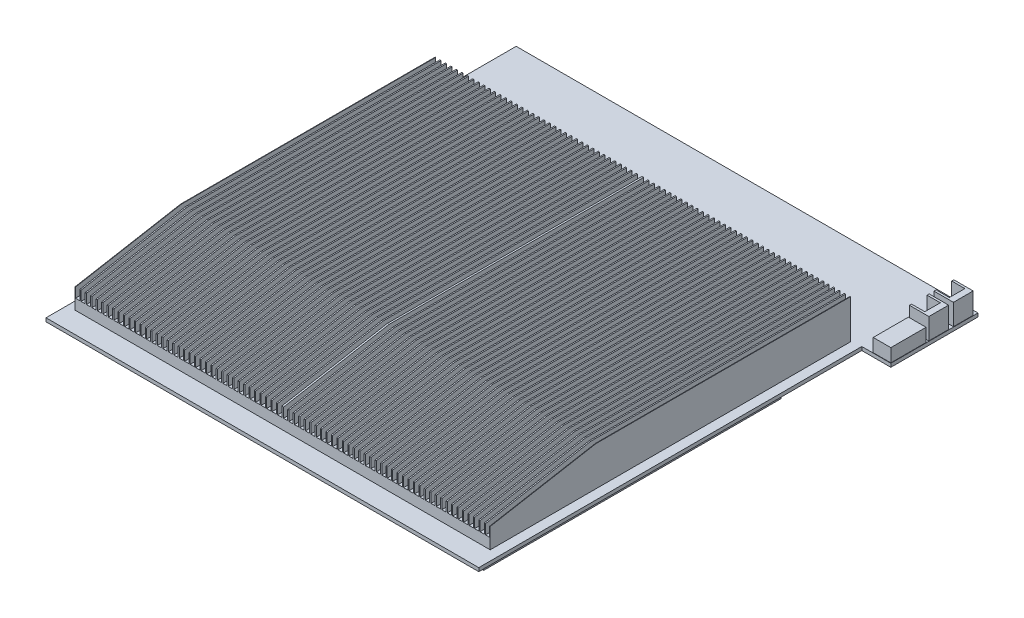
from build123d import *

# Parameters (mm, degrees)
BOSS_EXTRUDE1_DEPTH   = 2
SKETCH2_W             = 235.75
SKETCH2_H             = 204.5
BOSS_EXTRUDE2_DEPTH   = 22.2
CUT_EXTRUDE1_DEPTH    = 235.75
SKETCH5_W             = 27.3
SKETCH5_H             = 30.25
BOSS_EXTRUDE4_DEPTH   = 12.75
SKETCH6_W             = 2.4
SKETCH6_H             = 16.2
CUT_EXTRUDE2_DEPTH    = 341.929541841
SKETCH7_W             = 2.4
SKETCH7_H             = 10.810120739
CUT_EXTRUDE3_DEPTH    = 365.678988975
SKETCH8_W             = 10
SKETCH8_H             = 20
BOSS_EXTRUDE5_DEPTH   = 7.5
BOSS_EXTRUDE6_DEPTH   = 12
BOSS_EXTRUDE6_2_DEPTH = 12


with BuildPart() as part:
    # Sketch1 → Boss-Extrude1 (new body)
    with BuildSketch(Plane(origin=(0, 0, 0), x_dir=(1, 0, 0), z_dir=(0, 1, 0))):
        Polygon((0, 0), (0, 267), (262.25, 267), (262.25, 217.5), (245.75, 217.5), (245.75, 0), align=None)
    extrude(amount=BOSS_EXTRUDE1_DEPTH)

    # Sketch2 → Boss-Extrude2 (add)
    with BuildSketch(Plane(origin=(0, 2, 0), x_dir=(1, 0, 0), z_dir=(0, 1, 0))):
        with Locations((122.375, 114.25)):
            Rectangle(SKETCH2_W, SKETCH2_H)
    extrude(amount=BOSS_EXTRUDE2_DEPTH)

    # Sketch3 → Cut-Extrude1 (cut)
    with BuildSketch(Plane(origin=(240.25, 0, 0), x_dir=(0, 0, -1), z_dir=(1, 0, 0))):
        Polygon((12, 13.5), (72, 24.2), (12, 24.2), align=None)
    extrude(amount=-CUT_EXTRUDE1_DEPTH, mode=Mode.SUBTRACT)

    # Sketch5 → Boss-Extrude4 (add)
    with BuildSketch(Plane.XZ):
        Polygon((7.969075183, -183.75), (7.969075183, -14.75), (233.75849879, -14.75), (233.75849879, -183.75), (174.25849879, -183.75), (174.25849879, -216.5), (67.469075183, -216.5), (67.469075183, -183.75), align=None)
        with Locations((136.200813534, -246.375)):
            Rectangle(SKETCH5_W, SKETCH5_H)
    extrude(amount=BOSS_EXTRUDE4_DEPTH)

    # Sketch6 → Cut-Extrude2 (cut, through all)
    with BuildSketch(Plane(origin=(0, 0, -216.5), x_dir=(-1, 0, 0), z_dir=(0, 0, -1))):
        with Locations((-124.075, 16.1)):
            Rectangle(SKETCH6_W, SKETCH6_H)
        with Locations((-120.675, 16.1)):
            Rectangle(SKETCH6_W, SKETCH6_H)
        with Locations((-127.175, 16.1)):
            Rectangle(SKETCH6_W, SKETCH6_H)
        with Locations((-130.275, 16.1)):
            Rectangle(SKETCH6_W, SKETCH6_H)
        with Locations((-133.375, 16.1)):
            Rectangle(SKETCH6_W, SKETCH6_H)
        with Locations((-136.475, 16.1)):
            Rectangle(SKETCH6_W, SKETCH6_H)
        with Locations((-139.575, 16.1)):
            Rectangle(SKETCH6_W, SKETCH6_H)
        with Locations((-142.675, 16.1)):
            Rectangle(SKETCH6_W, SKETCH6_H)
        with Locations((-145.775, 16.1)):
            Rectangle(SKETCH6_W, SKETCH6_H)
        with Locations((-148.875, 16.1)):
            Rectangle(SKETCH6_W, SKETCH6_H)
        with Locations((-151.975, 16.1)):
            Rectangle(SKETCH6_W, SKETCH6_H)
        with Locations((-155.075, 16.1)):
            Rectangle(SKETCH6_W, SKETCH6_H)
        with Locations((-158.175, 16.1)):
            Rectangle(SKETCH6_W, SKETCH6_H)
        with Locations((-161.275, 16.1)):
            Rectangle(SKETCH6_W, SKETCH6_H)
        with Locations((-164.375, 16.1)):
            Rectangle(SKETCH6_W, SKETCH6_H)
        with Locations((-167.475, 16.1)):
            Rectangle(SKETCH6_W, SKETCH6_H)
        with Locations((-170.575, 16.1)):
            Rectangle(SKETCH6_W, SKETCH6_H)
        with Locations((-173.675, 16.1)):
            Rectangle(SKETCH6_W, SKETCH6_H)
        with Locations((-176.775, 16.1)):
            Rectangle(SKETCH6_W, SKETCH6_H)
        with Locations((-179.875, 16.1)):
            Rectangle(SKETCH6_W, SKETCH6_H)
        with Locations((-182.975, 16.1)):
            Rectangle(SKETCH6_W, SKETCH6_H)
        with Locations((-186.075, 16.1)):
            Rectangle(SKETCH6_W, SKETCH6_H)
        with Locations((-189.175, 16.1)):
            Rectangle(SKETCH6_W, SKETCH6_H)
        with Locations((-192.275, 16.1)):
            Rectangle(SKETCH6_W, SKETCH6_H)
        with Locations((-195.375, 16.1)):
            Rectangle(SKETCH6_W, SKETCH6_H)
        with Locations((-198.475, 16.1)):
            Rectangle(SKETCH6_W, SKETCH6_H)
        with Locations((-201.575, 16.1)):
            Rectangle(SKETCH6_W, SKETCH6_H)
        with Locations((-204.675, 16.1)):
            Rectangle(SKETCH6_W, SKETCH6_H)
        with Locations((-207.775, 16.1)):
            Rectangle(SKETCH6_W, SKETCH6_H)
        with Locations((-210.875, 16.1)):
            Rectangle(SKETCH6_W, SKETCH6_H)
        with Locations((-213.975, 16.1)):
            Rectangle(SKETCH6_W, SKETCH6_H)
        with Locations((-217.075, 16.1)):
            Rectangle(SKETCH6_W, SKETCH6_H)
        with Locations((-220.175, 16.1)):
            Rectangle(SKETCH6_W, SKETCH6_H)
        with Locations((-223.275, 16.1)):
            Rectangle(SKETCH6_W, SKETCH6_H)
        with Locations((-226.375, 16.1)):
            Rectangle(SKETCH6_W, SKETCH6_H)
        with Locations((-229.475, 16.1)):
            Rectangle(SKETCH6_W, SKETCH6_H)
        with Locations((-232.575, 16.1)):
            Rectangle(SKETCH6_W, SKETCH6_H)
        with Locations((-235.675, 16.1)):
            Rectangle(SKETCH6_W, SKETCH6_H)
        with Locations((-238.775, 16.1)):
            Rectangle(SKETCH6_W, SKETCH6_H)
        with Locations((-117.575, 16.1)):
            Rectangle(SKETCH6_W, SKETCH6_H)
        with Locations((-114.475, 16.1)):
            Rectangle(SKETCH6_W, SKETCH6_H)
        with Locations((-111.375, 16.1)):
            Rectangle(SKETCH6_W, SKETCH6_H)
        with Locations((-108.275, 16.1)):
            Rectangle(SKETCH6_W, SKETCH6_H)
        with Locations((-105.175, 16.1)):
            Rectangle(SKETCH6_W, SKETCH6_H)
        with Locations((-102.075, 16.1)):
            Rectangle(SKETCH6_W, SKETCH6_H)
        with Locations((-98.975, 16.1)):
            Rectangle(SKETCH6_W, SKETCH6_H)
        with Locations((-95.875, 16.1)):
            Rectangle(SKETCH6_W, SKETCH6_H)
        with Locations((-92.775, 16.1)):
            Rectangle(SKETCH6_W, SKETCH6_H)
        with Locations((-89.675, 16.1)):
            Rectangle(SKETCH6_W, SKETCH6_H)
        with Locations((-86.575, 16.1)):
            Rectangle(SKETCH6_W, SKETCH6_H)
        with Locations((-83.475, 16.1)):
            Rectangle(SKETCH6_W, SKETCH6_H)
        with Locations((-80.375, 16.1)):
            Rectangle(SKETCH6_W, SKETCH6_H)
        with Locations((-77.275, 16.1)):
            Rectangle(SKETCH6_W, SKETCH6_H)
        with Locations((-74.175, 16.1)):
            Rectangle(SKETCH6_W, SKETCH6_H)
        with Locations((-71.075, 16.1)):
            Rectangle(SKETCH6_W, SKETCH6_H)
        with Locations((-67.975, 16.1)):
            Rectangle(SKETCH6_W, SKETCH6_H)
        with Locations((-64.875, 16.1)):
            Rectangle(SKETCH6_W, SKETCH6_H)
        with Locations((-61.775, 16.1)):
            Rectangle(SKETCH6_W, SKETCH6_H)
        with Locations((-58.675, 16.1)):
            Rectangle(SKETCH6_W, SKETCH6_H)
        with Locations((-55.575, 16.1)):
            Rectangle(SKETCH6_W, SKETCH6_H)
        with Locations((-52.475, 16.1)):
            Rectangle(SKETCH6_W, SKETCH6_H)
        with Locations((-49.375, 16.1)):
            Rectangle(SKETCH6_W, SKETCH6_H)
        with Locations((-46.275, 16.1)):
            Rectangle(SKETCH6_W, SKETCH6_H)
        with Locations((-43.175, 16.1)):
            Rectangle(SKETCH6_W, SKETCH6_H)
        with Locations((-40.075, 16.1)):
            Rectangle(SKETCH6_W, SKETCH6_H)
        with Locations((-36.975, 16.1)):
            Rectangle(SKETCH6_W, SKETCH6_H)
        with Locations((-33.875, 16.1)):
            Rectangle(SKETCH6_W, SKETCH6_H)
        with Locations((-30.775, 16.1)):
            Rectangle(SKETCH6_W, SKETCH6_H)
        with Locations((-27.675, 16.1)):
            Rectangle(SKETCH6_W, SKETCH6_H)
        with Locations((-24.575, 16.1)):
            Rectangle(SKETCH6_W, SKETCH6_H)
        with Locations((-21.475, 16.1)):
            Rectangle(SKETCH6_W, SKETCH6_H)
        with Locations((-18.375, 16.1)):
            Rectangle(SKETCH6_W, SKETCH6_H)
        with Locations((-15.275, 16.1)):
            Rectangle(SKETCH6_W, SKETCH6_H)
        with Locations((-12.175, 16.1)):
            Rectangle(SKETCH6_W, SKETCH6_H)
        with Locations((-9.075, 16.1)):
            Rectangle(SKETCH6_W, SKETCH6_H)
        with Locations((-5.975, 16.1)):
            Rectangle(SKETCH6_W, SKETCH6_H)
    extrude(amount=-CUT_EXTRUDE2_DEPTH, mode=Mode.SUBTRACT)

    # Sketch7 → Cut-Extrude3 (cut, through all)
    with BuildSketch(Plane.XY.offset(-14.75)):
        with Locations((118.663786987, -7.34493963)):
            Rectangle(SKETCH7_W, SKETCH7_H)
        with Locations((123.063786987, -7.34493963)):
            Rectangle(SKETCH7_W, SKETCH7_H)
        with Locations((126.163786987, -7.34493963)):
            Rectangle(SKETCH7_W, SKETCH7_H)
        with Locations((129.263786987, -7.34493963)):
            Rectangle(SKETCH7_W, SKETCH7_H)
        with Locations((132.363786987, -7.34493963)):
            Rectangle(SKETCH7_W, SKETCH7_H)
        with Locations((135.463786987, -7.34493963)):
            Rectangle(SKETCH7_W, SKETCH7_H)
        with Locations((138.563786987, -7.34493963)):
            Rectangle(SKETCH7_W, SKETCH7_H)
        with Locations((141.663786987, -7.34493963)):
            Rectangle(SKETCH7_W, SKETCH7_H)
        with Locations((144.763786987, -7.34493963)):
            Rectangle(SKETCH7_W, SKETCH7_H)
        with Locations((147.863786987, -7.34493963)):
            Rectangle(SKETCH7_W, SKETCH7_H)
        with Locations((150.963786987, -7.34493963)):
            Rectangle(SKETCH7_W, SKETCH7_H)
        with Locations((154.063786987, -7.34493963)):
            Rectangle(SKETCH7_W, SKETCH7_H)
        with Locations((157.163786987, -7.34493963)):
            Rectangle(SKETCH7_W, SKETCH7_H)
        with Locations((160.263786987, -7.34493963)):
            Rectangle(SKETCH7_W, SKETCH7_H)
        with Locations((163.363786987, -7.34493963)):
            Rectangle(SKETCH7_W, SKETCH7_H)
        with Locations((166.463786987, -7.34493963)):
            Rectangle(SKETCH7_W, SKETCH7_H)
        with Locations((169.563786987, -7.34493963)):
            Rectangle(SKETCH7_W, SKETCH7_H)
        with Locations((172.663786987, -7.34493963)):
            Rectangle(SKETCH7_W, SKETCH7_H)
        with Locations((175.763786987, -7.34493963)):
            Rectangle(SKETCH7_W, SKETCH7_H)
        with Locations((178.863786987, -7.34493963)):
            Rectangle(SKETCH7_W, SKETCH7_H)
        with Locations((181.963786987, -7.34493963)):
            Rectangle(SKETCH7_W, SKETCH7_H)
        with Locations((185.063786987, -7.34493963)):
            Rectangle(SKETCH7_W, SKETCH7_H)
        with Locations((188.163786987, -7.34493963)):
            Rectangle(SKETCH7_W, SKETCH7_H)
        with Locations((191.263786987, -7.34493963)):
            Rectangle(SKETCH7_W, SKETCH7_H)
        with Locations((194.363786987, -7.34493963)):
            Rectangle(SKETCH7_W, SKETCH7_H)
        with Locations((197.463786987, -7.34493963)):
            Rectangle(SKETCH7_W, SKETCH7_H)
        with Locations((200.563786987, -7.34493963)):
            Rectangle(SKETCH7_W, SKETCH7_H)
        with Locations((203.663786987, -7.34493963)):
            Rectangle(SKETCH7_W, SKETCH7_H)
        with Locations((206.763786987, -7.34493963)):
            Rectangle(SKETCH7_W, SKETCH7_H)
        with Locations((209.863786987, -7.34493963)):
            Rectangle(SKETCH7_W, SKETCH7_H)
        with Locations((212.963786987, -7.34493963)):
            Rectangle(SKETCH7_W, SKETCH7_H)
        with Locations((216.063786987, -7.34493963)):
            Rectangle(SKETCH7_W, SKETCH7_H)
        with Locations((219.163786987, -7.34493963)):
            Rectangle(SKETCH7_W, SKETCH7_H)
        with Locations((222.263786987, -7.34493963)):
            Rectangle(SKETCH7_W, SKETCH7_H)
        with Locations((225.363786987, -7.34493963)):
            Rectangle(SKETCH7_W, SKETCH7_H)
        with Locations((228.463786987, -7.34493963)):
            Rectangle(SKETCH7_W, SKETCH7_H)
        with Locations((231.563786987, -7.34493963)):
            Rectangle(SKETCH7_W, SKETCH7_H)
        with Locations((115.563786987, -7.34493963)):
            Rectangle(SKETCH7_W, SKETCH7_H)
        with Locations((112.463786987, -7.34493963)):
            Rectangle(SKETCH7_W, SKETCH7_H)
        with Locations((109.363786987, -7.34493963)):
            Rectangle(SKETCH7_W, SKETCH7_H)
        with Locations((106.263786987, -7.34493963)):
            Rectangle(SKETCH7_W, SKETCH7_H)
        with Locations((103.163786987, -7.34493963)):
            Rectangle(SKETCH7_W, SKETCH7_H)
        with Locations((100.063786987, -7.34493963)):
            Rectangle(SKETCH7_W, SKETCH7_H)
        with Locations((96.963786987, -7.34493963)):
            Rectangle(SKETCH7_W, SKETCH7_H)
        with Locations((93.863786987, -7.34493963)):
            Rectangle(SKETCH7_W, SKETCH7_H)
        with Locations((90.763786987, -7.34493963)):
            Rectangle(SKETCH7_W, SKETCH7_H)
        with Locations((87.663786987, -7.34493963)):
            Rectangle(SKETCH7_W, SKETCH7_H)
        with Locations((84.563786987, -7.34493963)):
            Rectangle(SKETCH7_W, SKETCH7_H)
        with Locations((81.463786987, -7.34493963)):
            Rectangle(SKETCH7_W, SKETCH7_H)
        with Locations((78.363786987, -7.34493963)):
            Rectangle(SKETCH7_W, SKETCH7_H)
        with Locations((75.263786987, -7.34493963)):
            Rectangle(SKETCH7_W, SKETCH7_H)
        with Locations((72.163786987, -7.34493963)):
            Rectangle(SKETCH7_W, SKETCH7_H)
        with Locations((69.063786987, -7.34493963)):
            Rectangle(SKETCH7_W, SKETCH7_H)
        with Locations((65.963786987, -7.34493963)):
            Rectangle(SKETCH7_W, SKETCH7_H)
        with Locations((62.863786987, -7.34493963)):
            Rectangle(SKETCH7_W, SKETCH7_H)
        with Locations((59.763786987, -7.34493963)):
            Rectangle(SKETCH7_W, SKETCH7_H)
        with Locations((56.663786987, -7.34493963)):
            Rectangle(SKETCH7_W, SKETCH7_H)
        with Locations((53.563786987, -7.34493963)):
            Rectangle(SKETCH7_W, SKETCH7_H)
        with Locations((50.463786987, -7.34493963)):
            Rectangle(SKETCH7_W, SKETCH7_H)
        with Locations((47.363786987, -7.34493963)):
            Rectangle(SKETCH7_W, SKETCH7_H)
        with Locations((44.263786987, -7.34493963)):
            Rectangle(SKETCH7_W, SKETCH7_H)
        with Locations((41.163786987, -7.34493963)):
            Rectangle(SKETCH7_W, SKETCH7_H)
        with Locations((38.063786987, -7.34493963)):
            Rectangle(SKETCH7_W, SKETCH7_H)
        with Locations((34.963786987, -7.34493963)):
            Rectangle(SKETCH7_W, SKETCH7_H)
        with Locations((31.863786987, -7.34493963)):
            Rectangle(SKETCH7_W, SKETCH7_H)
        with Locations((28.763786987, -7.34493963)):
            Rectangle(SKETCH7_W, SKETCH7_H)
        with Locations((25.663786987, -7.34493963)):
            Rectangle(SKETCH7_W, SKETCH7_H)
        with Locations((22.563786987, -7.34493963)):
            Rectangle(SKETCH7_W, SKETCH7_H)
        with Locations((19.463786987, -7.34493963)):
            Rectangle(SKETCH7_W, SKETCH7_H)
        with Locations((16.363786987, -7.34493963)):
            Rectangle(SKETCH7_W, SKETCH7_H)
        with Locations((13.263786987, -7.34493963)):
            Rectangle(SKETCH7_W, SKETCH7_H)
        with Locations((10.163786987, -7.34493963)):
            Rectangle(SKETCH7_W, SKETCH7_H)
    extrude(amount=-CUT_EXTRUDE3_DEPTH, mode=Mode.SUBTRACT)


with BuildPart() as body_2:
    # Sketch8 → Boss-Extrude5 (new body)
    with BuildSketch(Plane(origin=(0, 2.2, 0), x_dir=(1, 0, 0), z_dir=(0, 1, 0))):
        with Locations((257.25, 227.5)):
            Rectangle(SKETCH8_W, SKETCH8_H)
    extrude(amount=BOSS_EXTRUDE5_DEPTH)


with BuildPart() as body_3:
    # Sketch9 → Boss-Extrude6 (new body)
    with BuildSketch(Plane(origin=(0, 2.2, 0), x_dir=(1, 0, 0), z_dir=(0, 1, 0))):
        Polygon((251.25, 253.05), (262.25, 253.05), (262.25, 264.25), (251.25, 264.25), (251.25, 263.05), (258.75, 263.05), (258.75, 254.25), (251.25, 254.25), align=None)
    extrude(amount=BOSS_EXTRUDE6_DEPTH)


with BuildPart() as body_4:
    # Sketch9 → Boss-Extrude6 2 (new body)
    with BuildSketch(Plane(origin=(0, 2.2, 0), x_dir=(1, 0, 0), z_dir=(0, 1, 0))):
        Polygon((251.25, 239.1), (262.25, 239.1), (262.25, 250.3), (251.25, 250.3), (251.25, 249.1), (258.75, 249.1), (258.75, 240.3), (251.25, 240.3), align=None)
    extrude(amount=BOSS_EXTRUDE6_2_DEPTH)


solid = Compound([part.part, body_2.part, body_3.part, body_4.part])
